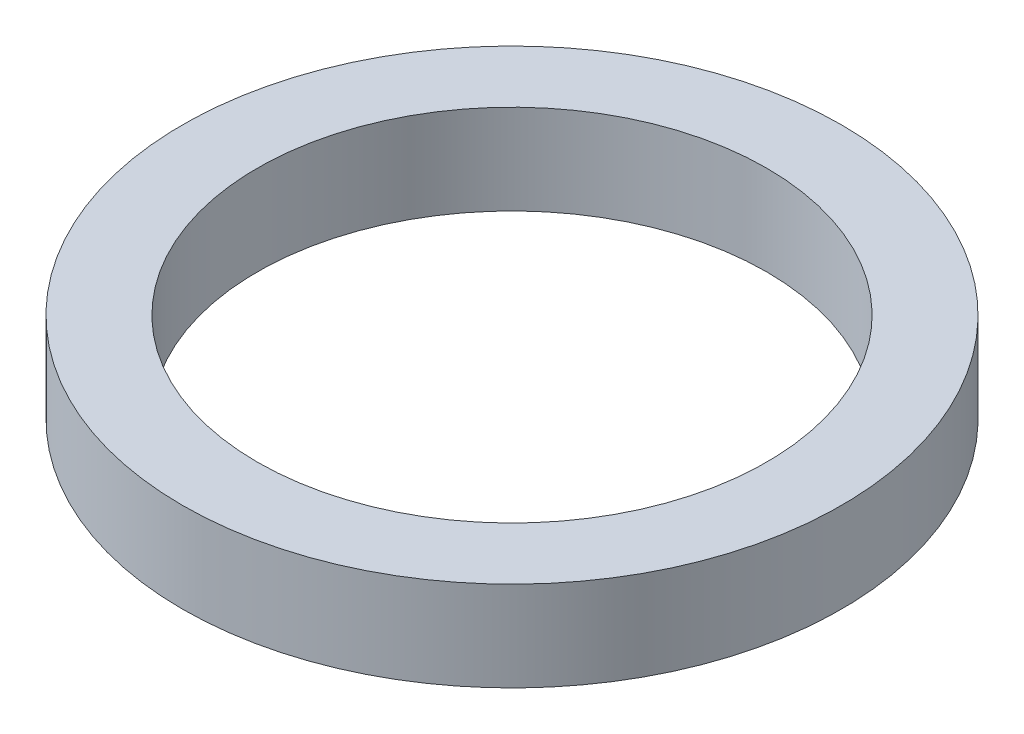
from build123d import *

# Parameters (mm, degrees)
SKETCH1_R           = 55
BOSS_EXTRUDE1_DEPTH = 15
SKETCH2_R           = 42.5
CUT_EXTRUDE1_DEPTH  = 80.214897589


with BuildPart() as part:
    # Sketch1 → Boss-Extrude1 (new body)
    with BuildSketch(Plane(origin=(0, 0, 0), x_dir=(1, 0, 0), z_dir=(0, 1, 0))):
        Circle(SKETCH1_R)
    extrude(amount=BOSS_EXTRUDE1_DEPTH)

    # Sketch2 → Cut-Extrude1 (cut, through all)
    with BuildSketch(Plane(origin=(0, 0, 0), x_dir=(1, 0, 0), z_dir=(0, 1, 0))):
        Circle(SKETCH2_R)
    extrude(amount=CUT_EXTRUDE1_DEPTH, mode=Mode.SUBTRACT)


solid = part.part
